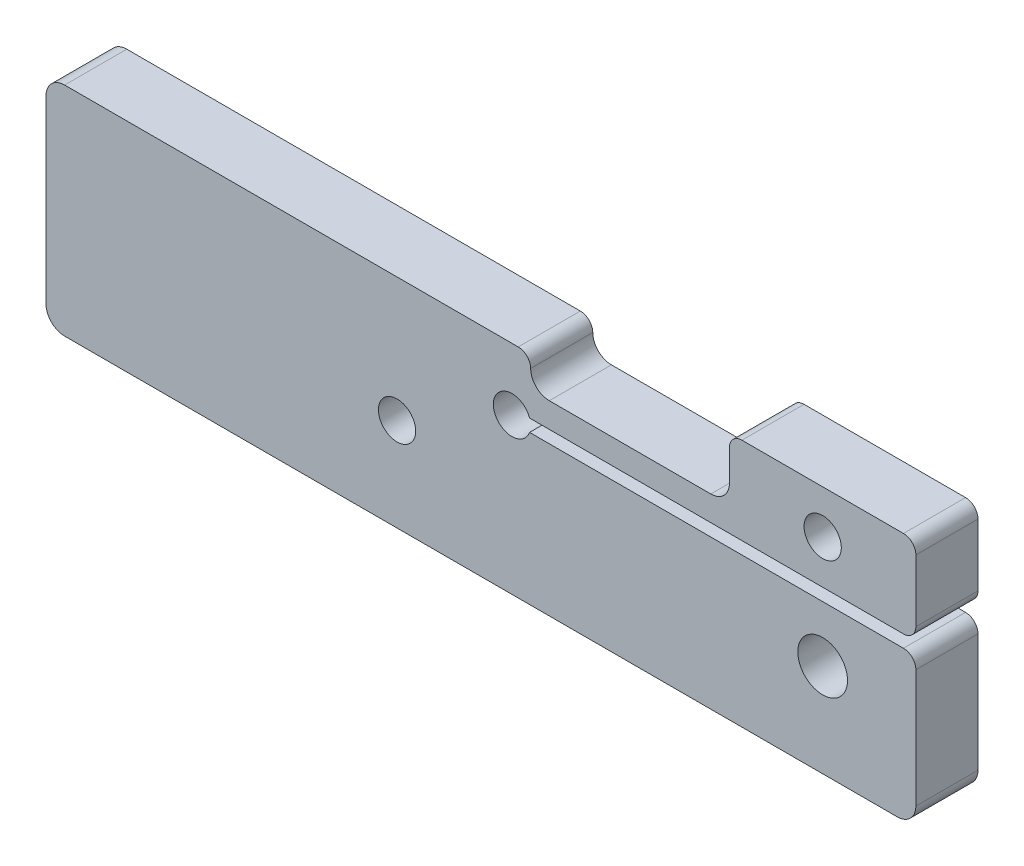
from build123d import *

# Parameters (mm, degrees)
ESQUISSE1_W                  = 140
ESQUISSE1_H                  = 35
BOSS_EXTRU_1_DEPTH           = 30
ESQUISSE2_W                  = 33
ESQUISSE2_H                  = 35
ENL_V_MAT_EXTRU_1_DEPTH      = 20
ESQUISSE3_W                  = 30
ESQUISSE3_H                  = 5
BOSS_EXTRU_2_DEPTH           = 30
ENL_V_MAT_EXTRU_2_DEPTH      = 149.660687473
ENL_V_MAT_EXTRU_2_DEPTH_BACK = 149.660687473
ESQUISSE4_R                  = 3
ENL_V_MAT_EXTRU_3_DEPTH      = 149.660687473
ENL_V_MAT_EXTRU_3_DEPTH_BACK = 149.660687473
ESQUISSE5_W                  = 65
ESQUISSE5_H                  = 2
ENL_V_MAT_EXTRU_4_DEPTH      = 149.660687473
ENL_V_MAT_EXTRU_4_DEPTH_BACK = 149.660687473
ESQUISSE6_W                  = 32
ESQUISSE6_H                  = 5
CONG_1_R                     = 3
ENL_V_MAT_EXTRU_6_DEPTH      = 15
ENL_V_MAT_EXTRU_5_DEPTH      = 149.660687473
ENL_V_MAT_EXTRU_5_DEPTH_BACK = 149.660687473
ESQUISSE7_R                  = 4
CONG_2_R                     = 3
CONG_3_R                     = 2
ENL_V_MAT_EXTRU_8_DEPTH      = 149.660687473
ENL_V_MAT_EXTRU_8_DEPTH_BACK = 149.660687473
ESQUISSE10_R                 = 3
ESQUISSE9_W                  = 140
ESQUISSE9_H                  = 40
ENL_V_MAT_EXTRU_7_DEPTH      = 20


with BuildPart() as part:
    # Esquisse1 → Boss.-Extru.1 (new body)
    with BuildSketch(Plane.XY):
        with Locations((70, 17.5)):
            Rectangle(ESQUISSE1_W, ESQUISSE1_H)
    extrude(amount=BOSS_EXTRU_1_DEPTH)

    # Esquisse2 → Enlèv. mat.-Extru.1 (cut)
    with BuildSketch(Plane.XY.offset(30)):
        with Locations((25, 17.5)):
            Rectangle(ESQUISSE2_W, ESQUISSE2_H)
    extrude(amount=-ENL_V_MAT_EXTRU_1_DEPTH, mode=Mode.SUBTRACT)

    # Esquisse3 → Boss.-Extru.2 (add)
    with BuildSketch(Plane.XY.offset(30)):
        with Locations((125, 37.5)):
            Rectangle(ESQUISSE3_W, ESQUISSE3_H)
    extrude(amount=-BOSS_EXTRU_2_DEPTH)

    # Esquisse4 → Enlèv. mat.-Extru.2 (cut, two sides: drawn at the far end of the back side and taken through both)
    with BuildSketch(Plane.XY.offset(30).offset(-ENL_V_MAT_EXTRU_2_DEPTH_BACK)):
        with Locations((75, 25)):
            Circle(ESQUISSE4_R)
    extrude(amount=ENL_V_MAT_EXTRU_2_DEPTH + ENL_V_MAT_EXTRU_2_DEPTH_BACK, mode=Mode.SUBTRACT)

    # Esquisse5 → Enlèv. mat.-Extru.3 (cut, two sides: drawn at the far end of the back side and taken through both)
    with BuildSketch(Plane.XY.offset(30).offset(-ENL_V_MAT_EXTRU_3_DEPTH_BACK)):
        with Locations((107.5, 25)):
            Rectangle(ESQUISSE5_W, ESQUISSE5_H)
    extrude(amount=ENL_V_MAT_EXTRU_3_DEPTH + ENL_V_MAT_EXTRU_3_DEPTH_BACK, mode=Mode.SUBTRACT)

    # Esquisse6 → Enlèv. mat.-Extru.4 (cut, two sides: drawn at the far end of the back side and taken through both)
    with BuildSketch(Plane.XY.offset(30).offset(-ENL_V_MAT_EXTRU_4_DEPTH_BACK)):
        with Locations((94, 32.5)):
            Rectangle(ESQUISSE6_W, ESQUISSE6_H)
    extrude(amount=ENL_V_MAT_EXTRU_4_DEPTH + ENL_V_MAT_EXTRU_4_DEPTH_BACK, mode=Mode.SUBTRACT)

    # Congé1
    cong_1_edges = [part.edges().sort_by_distance(p)[0] for p in [
        (78, 30, 15),
        (110, 30, 15),
    ]]
    fillet(cong_1_edges, radius=CONG_1_R)

    # Esquisse8 → Enlèv. mat.-Extru.6 (cut)
    with BuildSketch(Plane.XY.offset(30)):
        Polygon((72, 0), (140, 0), (140, 24), (106.275552162, 24), align=None)
    extrude(amount=-ENL_V_MAT_EXTRU_6_DEPTH, mode=Mode.SUBTRACT)

    # Esquisse7 → Enlèv. mat.-Extru.5 (cut, two sides: drawn at the far end of the back side and taken through both)
    with BuildSketch(Plane.XY.offset(30).offset(-ENL_V_MAT_EXTRU_5_DEPTH_BACK)):
        with Locations((125, 15)):
            Circle(ESQUISSE7_R)
    extrude(amount=ENL_V_MAT_EXTRU_5_DEPTH + ENL_V_MAT_EXTRU_5_DEPTH_BACK, mode=Mode.SUBTRACT)

    # Congé2
    cong_2_edges = [part.edges().sort_by_distance(p)[0] for p in [
        (140, 0, 7.5),
        (72, 0, 22.5),
        (0, 35, 15),
        (0, 0, 15),
    ]]
    fillet(cong_2_edges, radius=CONG_2_R)

    # Congé3
    cong_3_edges = [part.edges().sort_by_distance(p)[0] for p in [
        (106.275552162, 24, 22.5),
        (8.5, 0, 20),
        (8.5, 35, 20),
        (41.5, 35, 20),
        (41.5, 0, 20),
        (110, 40, 15),
        (140, 40, 15),
        (140, 26, 15),
        (140, 24, 7.5),
        (78, 35, 15),
    ]]
    fillet(cong_3_edges, radius=CONG_3_R - 0.0001)  # a hair under: the kernel refuses the full size

    # Esquisse10 → Enlèv. mat.-Extru.8 (cut, two sides: drawn at the far end of the back side and taken through both)
    with BuildSketch(Plane.XY.offset(30).offset(-ENL_V_MAT_EXTRU_8_DEPTH_BACK)):
        with Locations((56.5, 15)):
            Circle(ESQUISSE10_R)
        with Locations((125, 33)):
            Circle(ESQUISSE10_R)
    extrude(amount=ENL_V_MAT_EXTRU_8_DEPTH + ENL_V_MAT_EXTRU_8_DEPTH_BACK, mode=Mode.SUBTRACT)

    # Esquisse9 → Enlèv. mat.-Extru.7 (cut)
    with BuildSketch(Plane.XY.offset(30)):
        with Locations((70, 20)):
            Rectangle(ESQUISSE9_W, ESQUISSE9_H)
    extrude(amount=-ENL_V_MAT_EXTRU_7_DEPTH, mode=Mode.SUBTRACT)


solid = part.part
